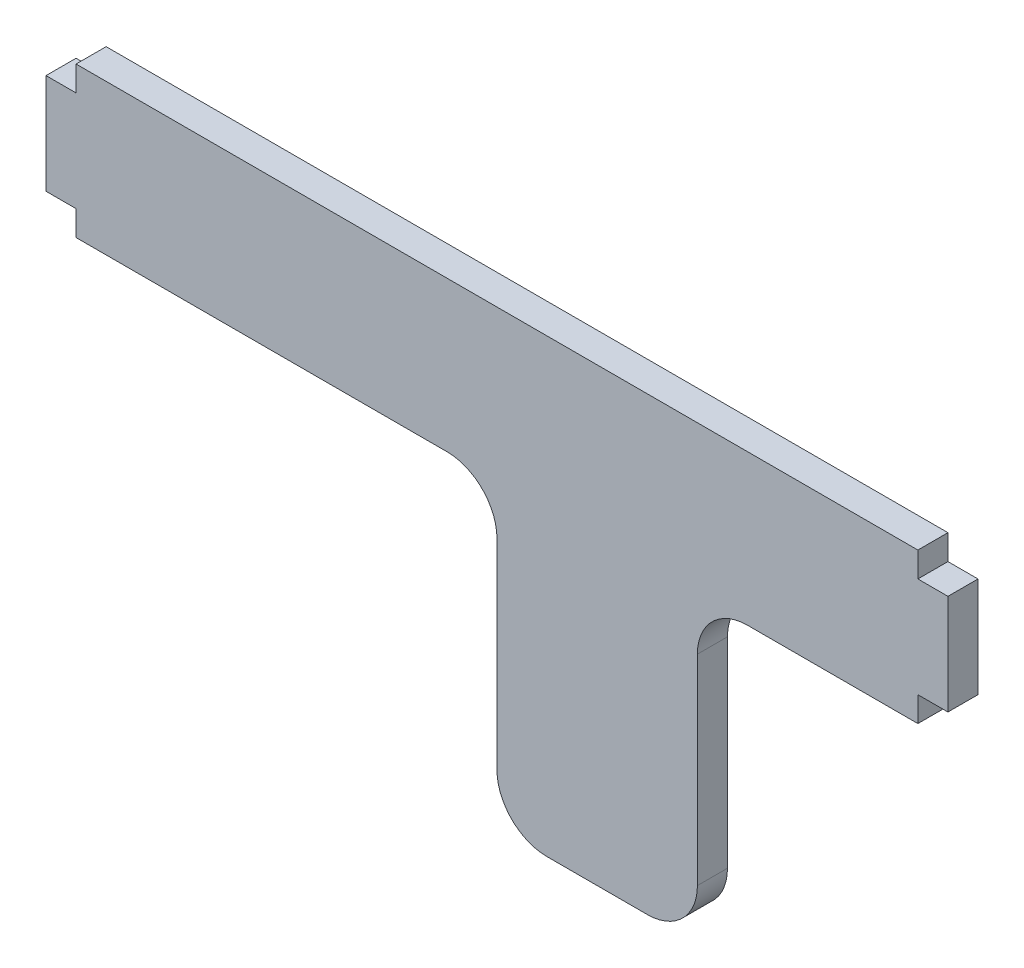
from build123d import *

# Parameters (mm, degrees)
RESSALTO_EXTRUS_O1_DEPTH = 3
FILETE1_R                = 5


with BuildPart() as part:
    # Esboço1 → Ressalto-extrusão1 (new body)
    with BuildSketch(Plane.XY):
        Polygon((20, -7.5), (42, -7.5), (42, -5), (45, -5), (45, 5), (42, 5), (42, 7.5), (-42, 7.5), (-42, 5), (-45, 5), (-45, -5), (-42, -5), (-42, -7.5), (0, -7.5), (0, -37.5), (20, -37.5), align=None)
    extrude(amount=RESSALTO_EXTRUS_O1_DEPTH)

    # Filete1
    filete1_edges = [part.edges().sort_by_distance(p)[0] for p in [
        (20, -37.5, 1.5),
        (0, -37.5, 1.5),
        (0, -7.5, 1.5),
        (20, -7.5, 1.5),
    ]]
    fillet(filete1_edges, radius=FILETE1_R)


solid = part.part
